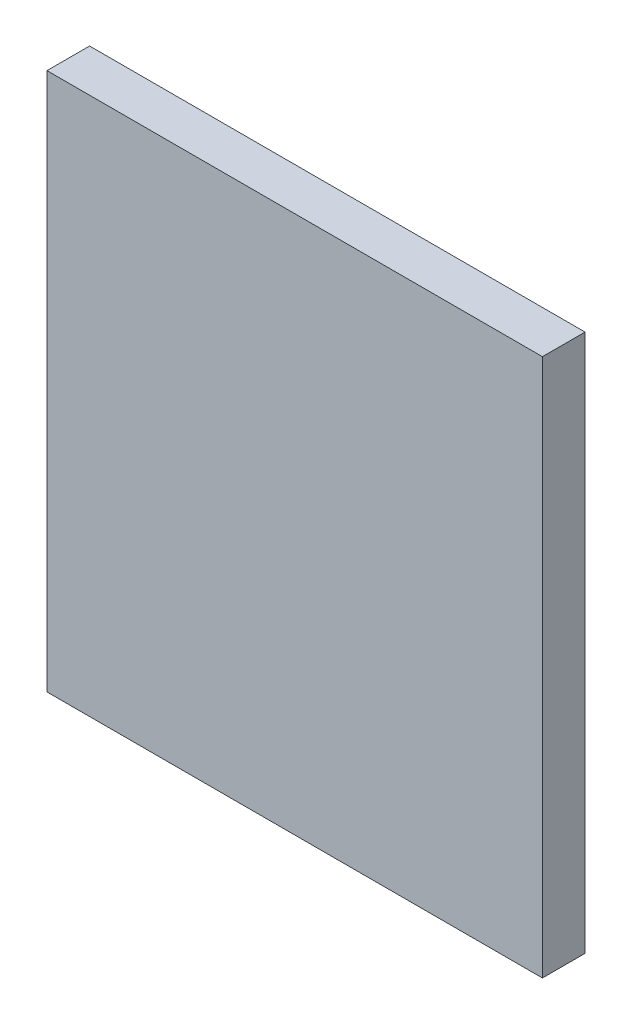
from build123d import *

# Parameters (mm, degrees)
SKETCH1_W           = 46.5
SKETCH1_H           = 50.5
BOSS_EXTRUDE1_DEPTH = 4


with BuildPart() as part:
    # Sketch1 → Boss-Extrude1 (new body)
    with BuildSketch(Plane.XY):
        Rectangle(SKETCH1_W, SKETCH1_H)
    extrude(amount=BOSS_EXTRUDE1_DEPTH)


solid = part.part
